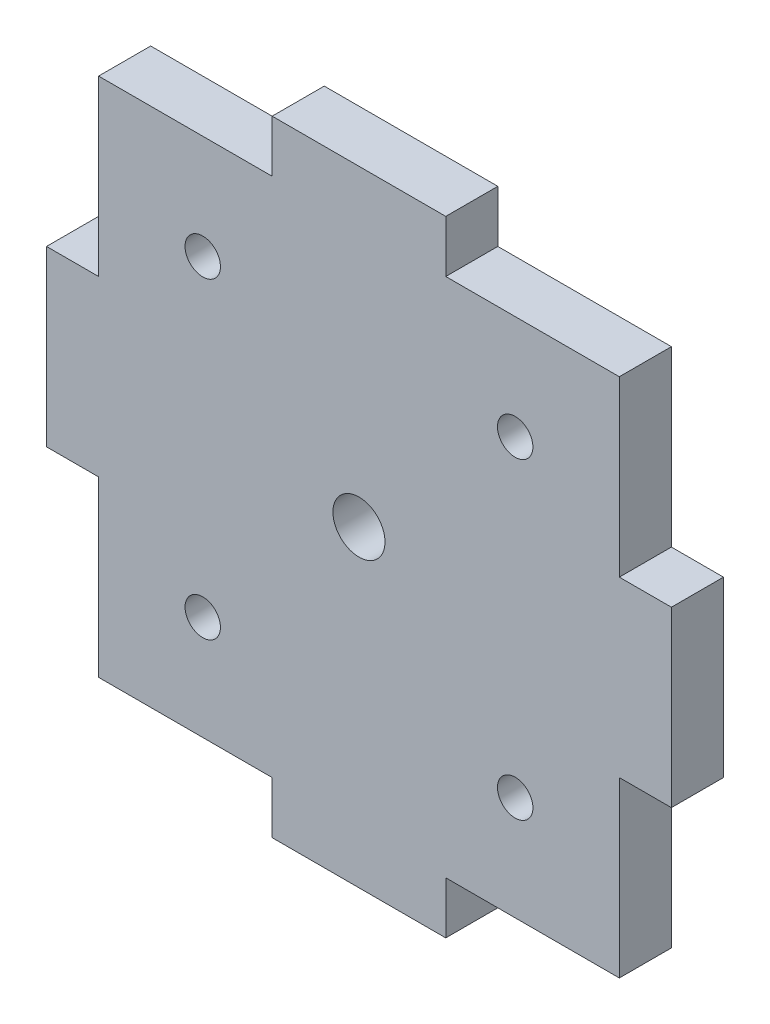
from build123d import *

# Parameters (mm, degrees)
BOSS_EXTRUDE1_DEPTH = 5
CAVITY1_OUTLINE_R   = 2.5
CAVITY1_OUTLINE_R_2 = 1.7
CAVITY1_DEPTH       = 5


# Read off the part's stored shape, not the designer's step: Cavity1
with BuildPart() as part:
    # Sketch1 → Boss-Extrude1 (new body)
    with BuildSketch(Plane.XY):
        Polygon((-22.75, 8.333333333), (-22.75, 25), (-6.083333333, 25), (-6.083333333, 30), (10.583333333, 30), (10.583333333, 25), (27.25, 25), (27.25, 8.333333333), (32.25, 8.333333333), (32.25, -8.333333333), (27.25, -8.333333333), (27.25, -25), (10.583333333, -25), (10.583333333, -30), (-6.083333333, -30), (-6.083333333, -25), (-22.75, -25), (-22.75, -8.333333333), (-27.75, -8.333333333), (-27.75, 8.333333333), align=None)
    extrude(amount=BOSS_EXTRUDE1_DEPTH)

    # Cavity1 outline → Cavity1 (cut)
    with BuildSketch(Plane.XY):
        with Locations((2.25, 0)):
            Circle(CAVITY1_OUTLINE_R)
        with Locations((-12.75, 15)):
            Circle(CAVITY1_OUTLINE_R_2)
        with Locations((17.25, 15)):
            Circle(CAVITY1_OUTLINE_R_2)
        with Locations((17.25, -15)):
            Circle(CAVITY1_OUTLINE_R_2)
        with Locations((-12.75, -15)):
            Circle(CAVITY1_OUTLINE_R_2)
    extrude(amount=CAVITY1_DEPTH, mode=Mode.SUBTRACT)


solid = part.part
